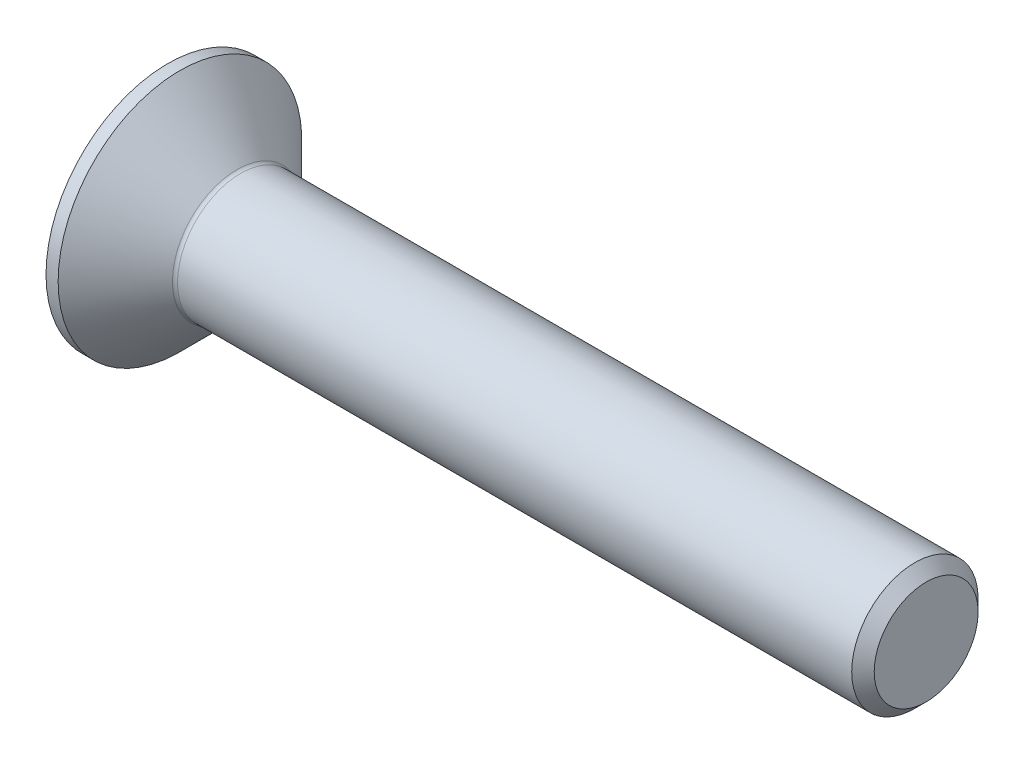
from build123d import *

# Parameters (mm, degrees)
FILLET1_R   = 0.2
HEX_START   = -2.3
HEX_2_DEPTH = 2.3


with BuildPart() as part:
    # BodySke → BaseBody (revolve)
    with BuildSketch(Plane.XY, mode=Mode.PRIVATE) as basebody_sk:
        Polygon((0, 0), (0, 4.82), (0.48, 4.82), (2.8, 2.5), (29.555, 2.5), (30, 2.055), (30, 0), align=None)
    revolve(basebody_sk.sketch.rotate(Axis((0, 0, 0), (1, 0, 0)), 90), axis=Axis((0, 0, 0), (1, 0, 0)))

    # Fillet1
    fillet1_edges = [part.edges().sort_by_distance(p)[0] for p in [
        (2.8, 0, -2.5),
    ]]
    fillet(fillet1_edges, radius=FILLET1_R)

    # Hex 2: read off the stored shape, not the designer's step
    # Hex 2 outline → Hex 2 (cut)
    with BuildSketch(Plane.ZY.offset(HEX_START)):
        Polygon((-1.51, -0.871798906), (0, -1.743597813), (1.51, -0.871798906), (1.51, 0.871798906), (0, 1.743597813), (-1.51, 0.871798906), align=None)
    extrude(amount=HEX_2_DEPTH, mode=Mode.SUBTRACT)

    # Hex 2 2 outline → Hex 2 2 (revolve, cut)
    with BuildSketch(Plane.YX):
        Polygon((1.51, 2.3), (0, 3.171798906), (0, 2.3), align=None)
    revolve(axis=Axis((0, 0, 0), (1, 0, 0)), mode=Mode.SUBTRACT)


solid = part.part
